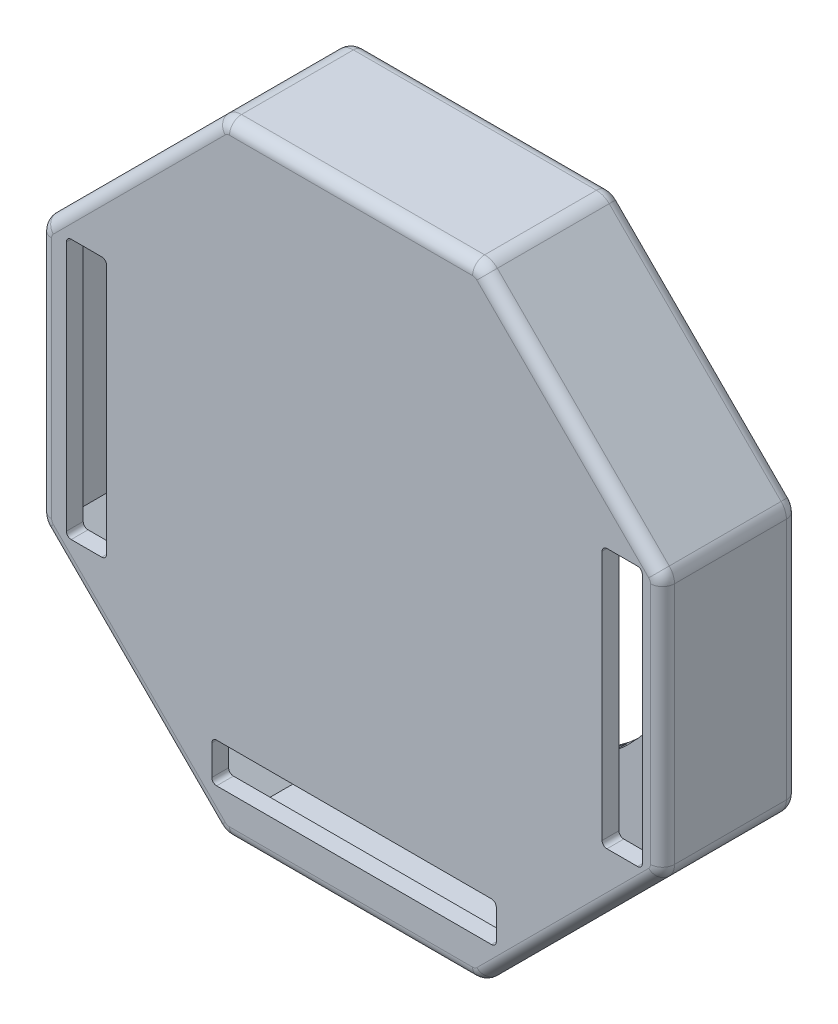
from build123d import *

# Parameters (mm, degrees)
BOSS_EXTRUDE1_DEPTH   = 8.5
BOSS_EXTRUDE1_2_DEPTH = 8.5
BOSS_EXTRUDE1_3_DEPTH = 8.5
BOSS_EXTRUDE1_4_DEPTH = 8.5
BOSS_EXTRUDE2_DEPTH   = 1.4
BOSS_EXTRUDE3_DEPTH   = 8.5
BOSS_EXTRUDE5_DEPTH   = 1
CUT_EXTRUDE1_DEPTH    = 38.942456431
CUT_EXTRUDE2_DEPTH    = 38.942456431
FILLET1_R             = 1
BOSS_EXTRUDE6_START   = 1.4
BOSS_EXTRUDE6_DEPTH   = 1.4
FILLET2_R             = 1
CUT_EXTRUDE3_DEPTH    = 1.4
BOSS_EXTRUDE7_DEPTH   = 0.25
FILLET3_R             = 10


with BuildPart() as part:
    # Sketch1 → Boss-Extrude1 (new body)
    with BuildSketch(Plane.XY):
        with BuildLine():
            Line((25.9, -10.106810922), (25.9, 10.106810922))
            ThreePointArc((25.9, 10.106810922), (25.785819299, 10.68083607), (25.460660172, 11.167471094))
            Line((25.460660172, 11.167471094), (22.50588745, 14.122243815))
            Line((22.50588745, 14.122243815), (21.515937957, 13.132294321))
            Line((21.515937957, 13.132294321), (24.5, 10.148232278))
            Line((24.5, 10.148232278), (24.5, -10.148232278))
            Line((24.5, -10.148232278), (21.692714652, -12.955517626))
            Line((21.692714652, -12.955517626), (22.682664146, -13.94546712))
            Line((22.682664146, -13.94546712), (25.460660172, -11.167471094))
            ThreePointArc((25.460660172, -11.167471094), (25.785819299, -10.68083607), (25.9, -10.106810922))
        make_face()
    extrude(amount=BOSS_EXTRUDE1_DEPTH)



with BuildPart() as body_2:
    # Sketch1 → Boss-Extrude1 2 (new body)
    with BuildSketch(Plane.XY):
        with BuildLine():
            Line((-16.177281759, -20.450849507), (-11.167471094, -25.460660172))
            ThreePointArc((-11.167471094, -25.460660172), (-10.68083607, -25.785819299), (-10.106810922, -25.9))
            Line((-10.106810922, -25.9), (10.106810922, -25.9))
            ThreePointArc((10.106810922, -25.9), (10.68083607, -25.785819299), (11.167471094, -25.460660172))
            Line((11.167471094, -25.460660172), (15.611596334, -21.016534932))
            Line((15.611596334, -21.016534932), (14.62164684, -20.026585438))
            Line((14.62164684, -20.026585438), (10.148232278, -24.5))
            Line((10.148232278, -24.5), (-10.148232278, -24.5))
            Line((-10.148232278, -24.5), (-15.187332265, -19.460900013))
            Line((-15.187332265, -19.460900013), (-16.177281759, -20.450849507))
        make_face()
    extrude(amount=BOSS_EXTRUDE1_2_DEPTH)


with BuildPart() as body_3:
    # Sketch1 → Boss-Extrude1 3 (new body)
    with BuildSketch(Plane.XY):
        with BuildLine():
            Line((-22.116978721, 14.511152545), (-25.460660172, 11.167471094))
            ThreePointArc((-25.460660172, 11.167471094), (-25.785819299, 10.68083607), (-25.9, 10.106810922))
            Line((-25.9, 10.106810922), (-25.9, -10.106810922))
            ThreePointArc((-25.9, -10.106810922), (-25.785819299, -10.68083607), (-25.460660172, -11.167471094))
            Line((-25.460660172, -11.167471094), (-22.187689399, -14.440441867))
            Line((-22.187689399, -14.440441867), (-21.197739905, -13.450492373))
            Line((-21.197739905, -13.450492373), (-24.5, -10.148232278))
            Line((-24.5, -10.148232278), (-24.5, 10.148232278))
            Line((-24.5, 10.148232278), (-21.127029227, 13.521203051))
            Line((-21.127029227, 13.521203051), (-22.116978721, 14.511152545))
        make_face()
    extrude(amount=BOSS_EXTRUDE1_3_DEPTH)


with BuildPart() as body_4:
    # Sketch1 → Boss-Extrude1 4 (new body)
    with BuildSketch(Plane.XY):
        with BuildLine():
            Line((10.106810922, 25.9), (-10.106810922, 25.9))
            ThreePointArc((-10.106810922, 25.9), (-10.68083607, 25.785819299), (-11.167471094, 25.460660172))
            Line((-11.167471094, 25.460660172), (-17.520784643, 19.107346623))
            Line((-17.520784643, 19.107346623), (-16.530835149, 18.117397129))
            Line((-16.530835149, 18.117397129), (-10.148232278, 24.5))
            Line((-10.148232278, 24.5), (10.148232278, 24.5))
            Line((10.148232278, 24.5), (16.919743879, 17.728488399))
            Line((16.919743879, 17.728488399), (17.909693373, 18.718437893))
            Line((17.909693373, 18.718437893), (11.167471094, 25.460660172))
            ThreePointArc((11.167471094, 25.460660172), (10.68083607, 25.785819299), (10.106810922, 25.9))
        make_face()
    extrude(amount=BOSS_EXTRUDE1_4_DEPTH)


with BuildPart() as part_1:
    add(part.part)

    add(body_2.part)  # Boss-Extrude2 merges body 2

    add(body_3.part)  # Boss-Extrude2 merges body 3

    add(body_4.part)  # Boss-Extrude2 merges body 4
    # Sketch2 → Boss-Extrude2 (add)
    with BuildSketch(Plane.XY.offset(8.5)):
        with BuildLine():
            ThreePointArc((25.460660172, -11.167471094), (25.785819299, -10.68083607), (25.9, -10.106810922))
            Line((25.9, -10.106810922), (25.9, 10.106810922))
            ThreePointArc((25.9, 10.106810922), (25.785819299, 10.68083607), (25.460660172, 11.167471094))
            Line((25.460660172, 11.167471094), (11.167471094, 25.460660172))
            ThreePointArc((11.167471094, 25.460660172), (10.68083607, 25.785819299), (10.106810922, 25.9))
            Line((10.106810922, 25.9), (-10.106810922, 25.9))
            ThreePointArc((-10.106810922, 25.9), (-10.68083607, 25.785819299), (-11.167471094, 25.460660172))
            Line((-11.167471094, 25.460660172), (-25.460660172, 11.167471094))
            ThreePointArc((-25.460660172, 11.167471094), (-25.785819299, 10.68083607), (-25.9, 10.106810922))
            Line((-25.9, 10.106810922), (-25.9, -10.106810922))
            ThreePointArc((-25.9, -10.106810922), (-25.785819299, -10.68083607), (-25.460660172, -11.167471094))
            Line((-25.460660172, -11.167471094), (-11.167471094, -25.460660172))
            ThreePointArc((-11.167471094, -25.460660172), (-10.68083607, -25.785819299), (-10.106810922, -25.9))
            Line((-10.106810922, -25.9), (10.106810922, -25.9))
            ThreePointArc((10.106810922, -25.9), (10.68083607, -25.785819299), (11.167471094, -25.460660172))
            Line((11.167471094, -25.460660172), (25.460660172, -11.167471094))
        make_face()
    extrude(amount=BOSS_EXTRUDE2_DEPTH)

    # Sketch3 → Boss-Extrude3 (add)
    with BuildSketch(Plane(origin=(0, 0, 8.5), x_dir=(-1, 0, 0), z_dir=(0, 0, -1))):
        Polygon((-21.515937957, 13.132294321), (-16.919743879, 17.728488399), (-17.909693373, 18.718437893), (-22.50588745, 14.122243815), align=None)
        Polygon((21.127029227, 13.521203051), (16.530835149, 18.117397129), (17.520784643, 19.107346623), (22.116978721, 14.511152545), align=None)
        Polygon((-21.692714652, -12.955517626), (-22.682664146, -13.94546712), (-15.611596334, -21.016534932), (-14.62164684, -20.026585438), align=None)
        Polygon((15.187332265, -19.460900013), (16.177281759, -20.450849507), (22.187689399, -14.440441867), (21.197739905, -13.450492373), align=None)
    extrude(amount=BOSS_EXTRUDE3_DEPTH)

    # Sketch5 → Boss-Extrude5 (add)
    with BuildSketch(Plane(origin=(0, 0, 8.5), x_dir=(-1, 0, 0), z_dir=(0, 0, -1))):
        Polygon((16.177281759, -20.450849507), (22.187689399, -14.440441867), (21.197739905, -13.450492373), (15.187332265, -19.460900013), align=None)
    extrude(amount=BOSS_EXTRUDE5_DEPTH)

    # Sketch6 → Cut-Extrude1 (cut, through all)
    with BuildSketch(Plane.XY.offset(9.9)):
        with BuildLine():
            Line((-20.332854575, -10.39399953), (-20.332854823, 10.43400047))
            ThreePointArc((-20.332854823, 10.43400047), (-20.450012114, 10.716843181), (-20.732854828, 10.834000465))
            Line((-20.732854828, 10.834000465), (-23.272854828, 10.834000435))
            ThreePointArc((-23.272854828, 10.834000435), (-23.555697539, 10.716843144), (-23.672854823, 10.43400043))
            Line((-23.672854823, 10.43400043), (-23.672854575, -10.39399957))
            ThreePointArc((-23.672854575, -10.39399957), (-23.555697284, -10.676842281), (-23.27285457, -10.793999565))
            Line((-23.27285457, -10.793999565), (-20.73285457, -10.793999535))
            ThreePointArc((-20.73285457, -10.793999535), (-20.450011859, -10.676842244), (-20.332854575, -10.39399953))
        make_face()
        with BuildLine():
            Line((21.277947318, -10.789000444), (23.817947318, -10.789000333))
            ThreePointArc((23.817947318, -10.789000333), (24.100790025, -10.671843033), (24.217947301, -10.389000316))
            Line((24.217947301, -10.389000316), (24.21794639, 10.438999684))
            ThreePointArc((24.21794639, 10.438999684), (24.10078909, 10.721842391), (23.817946373, 10.838999667))
            Line((23.817946373, 10.838999667), (21.277946373, 10.838999556))
            ThreePointArc((21.277946373, 10.838999556), (20.995103665, 10.721842256), (20.87794639, 10.438999538))
            Line((20.87794639, 10.438999538), (20.877947301, -10.389000462))
            ThreePointArc((20.877947301, -10.389000462), (20.995104601, -10.671843169), (21.277947318, -10.789000444))
        make_face()
    extrude(amount=-CUT_EXTRUDE1_DEPTH, mode=Mode.SUBTRACT)

    # Sketch7 → Cut-Extrude2 (cut, through all)
    # profile 1 of 2: a face of its own
    with BuildSketch(Plane.XY.offset(9.9)):
        with BuildLine():
            ThreePointArc((-11.582455432, -19.595401386), (-11.465298194, -19.312558653), (-11.182455502, -19.195401316))
            Line((-11.182455502, -19.195401316), (11.677544498, -19.195397319))
            ThreePointArc((11.677544498, -19.195397319), (11.960387231, -19.312554557), (12.077544568, -19.595397249))
            Line((12.077544568, -19.595397249), (12.077545003, -22.084597249))
            ThreePointArc((12.077545003, -22.084597249), (11.960387765, -22.367439982), (11.677545073, -22.484597319))
            Line((11.677545073, -22.484597319), (9.391545073, -22.484597719))
            Line((9.391545073, -22.484597719), (-8.896454927, -22.484600916))
            Line((-8.896454927, -22.484600916), (-11.182454927, -22.484601316))
            ThreePointArc((-11.182454927, -22.484601316), (-11.46529766, -22.367444078), (-11.582454997, -22.084601386))
            Line((-11.582454997, -22.084601386), (-11.582455432, -19.595401386))
        make_face()
        Polygon((9.391545003, -22.084597719), (11.677545003, -22.084597319), (11.677544568, -19.595397319), (-11.182455432, -19.595401316), (-11.182454997, -22.084601316), (-8.896454997, -22.084600916), align=None, mode=Mode.SUBTRACT)
    # profile 2 of 2: a face of its own
    with BuildSketch(Plane.XY.offset(9.9)):
        Polygon((9.391545003, -22.084597719), (-8.896454997, -22.084600916), (-11.182454997, -22.084601316), (-11.182455432, -19.595401316), (11.677544568, -19.595397319), (11.677545003, -22.084597319), align=None)
    extrude(amount=-CUT_EXTRUDE2_DEPTH, mode=Mode.SUBTRACT)

    # Fillet1
    fillet1_edges = [part_1.edges().sort_by_distance(p)[0] for p in [
        (18.314065633, 18.314065633, 9.9),
        (10.68083607, 25.785819299, 9.9),
        (0, 25.9, 9.9),
        (-10.68083607, 25.785819299, 9.9),
        (-18.314065633, 18.314065633, 9.9),
        (-25.785819299, 10.68083607, 9.9),
        (-25.9, 0, 9.9),
        (-25.785819299, -10.68083607, 9.9),
        (-18.314065633, -18.314065633, 9.9),
        (-10.68083607, -25.785819299, 9.9),
        (0, -25.9, 9.9),
        (10.68083607, -25.785819299, 9.9),
        (18.314065633, -18.314065633, 9.9),
        (25.785819299, -10.68083607, 9.9),
        (25.9, 0, 9.9),
        (25.785819299, 10.68083607, 9.9),
    ]]
    fillet(fillet1_edges, radius=FILLET1_R)

    # Sketch8 → Boss-Extrude6 (add)
    with BuildSketch(Plane(origin=(0, 0, 0), x_dir=(-1, 0, 0), z_dir=(0, 0, -1)).offset(BOSS_EXTRUDE6_START)):
        with BuildLine():
            Line((-11.167471094, 25.460660172), (-25.460660172, 11.167471094))
            ThreePointArc((-25.460660172, 11.167471094), (-25.785819299, 10.68083607), (-25.9, 10.106810922))
            Line((-25.9, 10.106810922), (-25.9, -10.106810922))
            ThreePointArc((-25.9, -10.106810922), (-25.785819299, -10.68083607), (-25.460660172, -11.167471094))
            Line((-25.460660172, -11.167471094), (-11.167471094, -25.460660172))
            ThreePointArc((-11.167471094, -25.460660172), (-10.68083607, -25.785819299), (-10.106810922, -25.9))
            Line((-10.106810922, -25.9), (10.106810922, -25.9))
            ThreePointArc((10.106810922, -25.9), (10.68083607, -25.785819299), (11.167471094, -25.460660172))
            Line((11.167471094, -25.460660172), (25.460660172, -11.167471094))
            ThreePointArc((25.460660172, -11.167471094), (25.785819299, -10.68083607), (25.9, -10.106810922))
            Line((25.9, -10.106810922), (25.9, 10.106810922))
            ThreePointArc((25.9, 10.106810922), (25.785819299, 10.68083607), (25.460660172, 11.167471094))
            Line((25.460660172, 11.167471094), (11.167471094, 25.460660172))
            ThreePointArc((11.167471094, 25.460660172), (10.68083607, 25.785819299), (10.106810922, 25.9))
            Line((10.106810922, 25.9), (-10.106810922, 25.9))
            ThreePointArc((-10.106810922, 25.9), (-10.68083607, 25.785819299), (-11.167471094, 25.460660172))
        make_face()
    extrude(amount=-BOSS_EXTRUDE6_DEPTH)

    # Fillet2
    fillet2_edges = [part_1.edges().sort_by_distance(p)[0] for p in [
        (10.68083607, 25.785819299, -1.4),
        (18.314065633, 18.314065633, -1.4),
        (25.785819299, 10.68083607, -1.4),
        (25.9, 0, -1.4),
        (25.785819299, -10.68083607, -1.4),
        (18.314065633, -18.314065633, -1.4),
        (10.68083607, -25.785819299, -1.4),
        (0, -25.9, -1.4),
        (-10.68083607, -25.785819299, -1.4),
        (-18.314065633, -18.314065633, -1.4),
        (-25.785819299, -10.68083607, -1.4),
        (-25.9, 0, -1.4),
        (-25.785819299, 10.68083607, -1.4),
        (-18.314065633, 18.314065633, -1.4),
        (-10.68083607, 25.785819299, -1.4),
        (0, 25.9, -1.4),
    ]]
    fillet(fillet2_edges, radius=FILLET2_R)

    # Sketch9 → Cut-Extrude3 (cut)
    with BuildSketch(Plane(origin=(0, 0, -1.4), x_dir=(-1, 0, 0), z_dir=(0, 0, -1))):
        with BuildLine():
            ThreePointArc((17.5, 0.5), (-9.5, 16.088457268), (-9.5, -15.088457268))
            Line((-9.5, -15.088457268), (8.5, -15.088457268))
            ThreePointArc((8.5, -15.088457268), (15.088457268, -8.5), (17.5, 0.5))
        make_face()
        with BuildLine():
            Line((8.5, -15.088457268), (-9.5, -15.088457268))
            ThreePointArc((-9.5, -15.088457268), (-0.5, -17.5), (8.5, -15.088457268))
        make_face()
        with BuildLine():
            ThreePointArc((8.5, -15.088457268), (-0.5, -17.5), (-9.5, -15.088457268))
            Line((-9.5, -15.088457268), (-8, -21.588457268))
            Line((-8, -21.588457268), (7, -21.588457268))
            Line((7, -21.588457268), (8.5, -15.088457268))
        make_face()
    extrude(amount=-CUT_EXTRUDE3_DEPTH, mode=Mode.SUBTRACT)

    # Sketch9<3> → Boss-Extrude7 (add)
    with BuildSketch(Plane(origin=(0, 0, -1.4), x_dir=(-1, 0, 0), z_dir=(0, 0, -1))):
        with BuildLine():
            ThreePointArc((8.5, -15.088457268), (-0.5, -17.5), (-9.5, -15.088457268))
            Line((-9.5, -15.088457268), (-8, -21.588457268))
            Line((-8, -21.588457268), (7, -21.588457268))
            Line((7, -21.588457268), (8.5, -15.088457268))
        make_face()
    extrude(amount=-BOSS_EXTRUDE7_DEPTH)

    # Fillet3
    # the kernel refuses this fillet: 10 mm, written as the material it takes off along each edge
    with BuildSketch(Plane(origin=(9.5, -15.088457268, -1.15), x_dir=(0.8205991500669837, 0.5715041862570599, 0), z_dir=(0, 0, 1))) as fillet3_piece_1_section:
        with BuildLine():
            CenterArc((3.893328157, -9.964118034), FILLET3_R, 94.85518398, 37.295015249)
            Line((-2.817436219, -2.550236359), (0, 0))
            ThreePointArc((0, 0), (1.523476235, -0.064587539), (3.046952471, 0))
        make_face()
    fillet3_piece_1 = extrude(amount=10.650543516, mode=Mode.PRIVATE)
    fillet3_piece_1 = split(fillet3_piece_1, bisect_by=Plane(origin=(9.843769385, -15.549562691, 8.5), z_dir=(0, 0, -1)), keep=Keep.TOP, mode=Mode.PRIVATE)
    add(fillet3_piece_1, mode=Mode.SUBTRACT)
    with BuildSketch(Plane(origin=(-8.5, -15.088457268, -1.15), x_dir=(-0.8205991500669784, 0.5715041862570673, 0), z_dir=(0, 0, 1))) as fillet3_piece_2_section:
        with BuildLine():
            CenterArc((3.893328157, 9.964118034), FILLET3_R, 227.849800771, 37.295015249)
            Line((-2.817436219, 2.550236359), (0, 0))
            ThreePointArc((0, 0), (1.523476235, 0.064587539), (3.046952471, 0))
        make_face()
    fillet3_piece_2 = extrude(amount=10.650543516, mode=Mode.PRIVATE)
    fillet3_piece_2 = split(fillet3_piece_2, bisect_by=Plane(origin=(-8.843769385, -15.549562691, 8.5), z_dir=(0, 0, -1)), keep=Keep.TOP, mode=Mode.PRIVATE)
    add(fillet3_piece_2, mode=Mode.SUBTRACT)


solid = part_1.part
